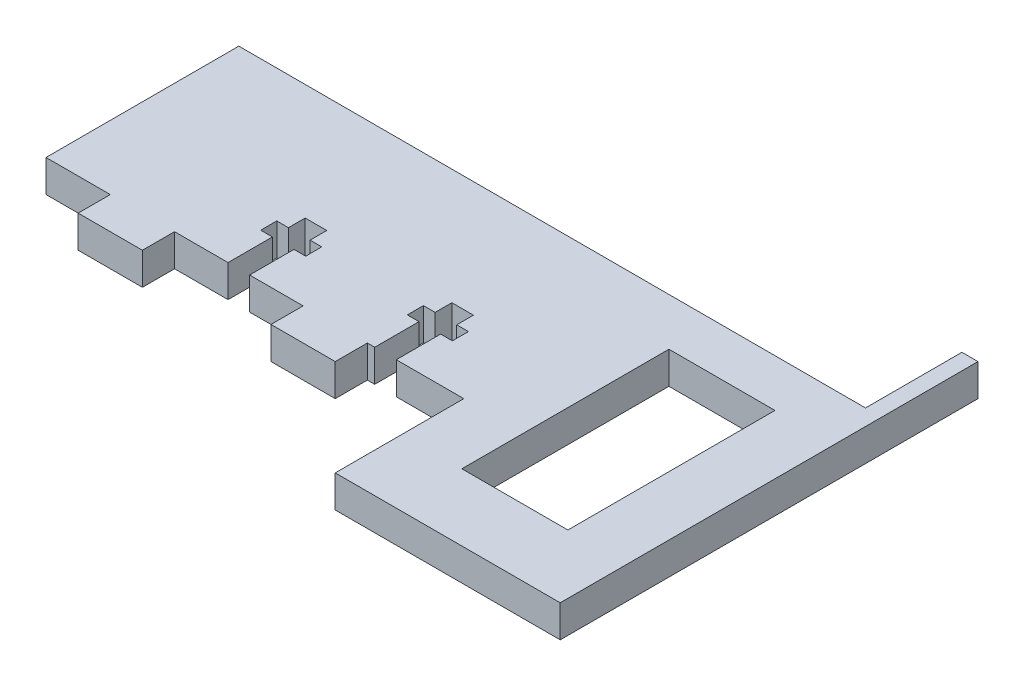
from build123d import *

# Parameters (mm, degrees)
BOSS_EXTRUDE1_DEPTH = 6.35
SKETCH4_W           = 20.950480973
SKETCH4_H           = 40.91890815
CUT_EXTRUDE2_DEPTH  = 79.730852648
SKETCH5_R           = 1.778
SKETCH5_W           = 123.825
SKETCH5_H           = 19.05
CUT_EXTRUDE3_DEPTH  = 79.730852648
CUT_EXTRUDE4_DEPTH  = 79.730852648


with BuildPart() as part:
    # Sketch1 → Boss-Extrude1 (new body)
    with BuildSketch(Plane(origin=(0, 0, 0), x_dir=(1, 0, 0), z_dir=(0, 1, 0))):
        Polygon((64.810443043, 44.247385587), (64.810443043, -38.302614413), (20.360443043, -38.302614413), (20.360443043, -12.902614413), (1.310443043, -12.902614413), (1.310443043, -19.252614413), (-11.389556957, -19.252614413), (-11.389556957, -12.902614413), (-36.789556957, -12.902614413), (-36.789556957, -19.252614413), (-49.489556957, -19.252614413), (-49.489556957, -12.902614413), (-62.189556957, -12.902614413), (-62.189556957, 44.247385587), align=None)
    extrude(amount=BOSS_EXTRUDE1_DEPTH)

    # Sketch4 → Cut-Extrude2 (cut, through all)
    with BuildSketch(Plane.XZ):
        with Locations((42.642368246, 4.632403749)):
            Rectangle(SKETCH4_W, SKETCH4_H)
    extrude(amount=-CUT_EXTRUDE2_DEPTH, mode=Mode.SUBTRACT)

    # Sketch5 → Cut-Extrude3 (cut, through all)
    with BuildSketch(Plane(origin=(0, 6.35, 0), x_dir=(1, 0, 0), z_dir=(0, 1, 0))):
        with Locations((47.416220416, -54.66072167)):
            Circle(SKETCH5_R)
        with Locations((37.416958758, -54.539205023)):
            Circle(SKETCH5_R)
        with Locations((48.011651983, -5.664339546)):
            Circle(SKETCH5_R)
        with Locations((38.012390325, -5.542822899)):
            Circle(SKETCH5_R)
        with Locations((-0.277056957, 34.722385587)):
            Rectangle(SKETCH5_W, SKETCH5_H)
    extrude(amount=-CUT_EXTRUDE3_DEPTH, mode=Mode.SUBTRACT)

    # Sketch6 → Cut-Extrude4 (cut, through all)
    with BuildSketch(Plane(origin=(0, 6.35, 0), x_dir=(1, 0, 0), z_dir=(0, 1, 0))):
        Polygon((2.758977506, -12.902614413), (7.026177506, -12.902614413), (7.026177506, -4.139614413), (9.337577506, -4.139614413), (9.337577506, -0.964614413), (7.026177506, -0.964614413), (7.026177506, 2.337385587), (2.758977506, 2.337385587), (2.758977506, -0.964614413), (0.447577506, -0.964614413), (0.447577506, -4.139614413), (2.758977506, -4.139614413), align=None)
        Polygon((-26.223156957, -12.902614413), (-21.955956957, -12.902614413), (-21.955956957, -4.139614413), (-19.644556957, -4.139614413), (-19.644556957, -0.964614413), (-21.955956957, -0.964614413), (-21.955956957, 2.337385587), (-26.223156957, 2.337385587), (-26.223156957, -0.964614413), (-28.534556957, -0.964614413), (-28.534556957, -4.139614413), (-26.223156957, -4.139614413), align=None)
    extrude(amount=-CUT_EXTRUDE4_DEPTH, mode=Mode.SUBTRACT)


solid = part.part
